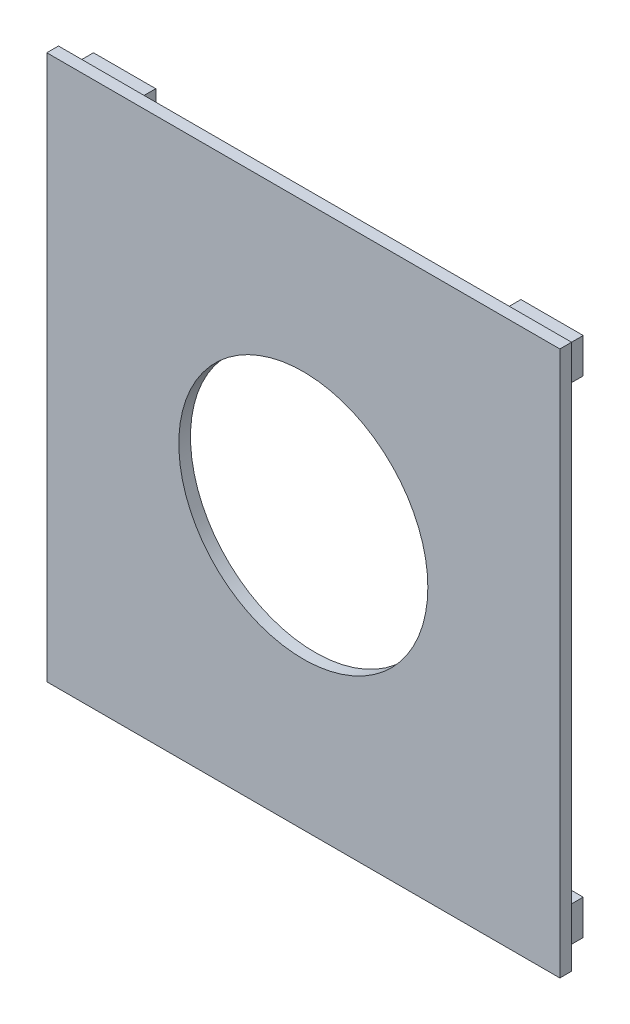
from build123d import *

# Parameters (mm, degrees)
SKETCH1_W                 = 65.925
SKETCH1_H                 = 70
BOSS_EXTRUDE1_DEPTH       = 1.5
SKETCH4_W                 = 8
SKETCH4_H                 = 4.5
SKETCH4_W_2               = 5
SKETCH4_H_2               = 1.5
BOSS_EXTRUDE2_DEPTH       = 3
MIRROR2_COPY_1_SKETCH_W   = 8
MIRROR2_COPY_1_SKETCH_H   = 4.5
MIRROR2_COPY_1_SKETCH_W_2 = 5
MIRROR2_COPY_1_SKETCH_H_2 = 1.5
MIRROR2_COPY_1_DEPTH      = 3
CUT_EXTRUDE1_REACH        = 137.335
SKETCH5_R                 = 16


with BuildPart() as part:
    # Sketch1 → Boss-Extrude1 (new body)
    with BuildSketch(Plane.XY):
        with Locations((88.1375, 25.25)):
            Rectangle(SKETCH1_W, SKETCH1_H)
    extrude(amount=BOSS_EXTRUDE1_DEPTH)

    # Sketch4 → Boss-Extrude2 (add)
    with BuildSketch(Plane(origin=(0, 0, 0), x_dir=(-1, 0, 0), z_dir=(0, 0, -1))):
        with Locations((-115.6, 56.5)):
            Rectangle(SKETCH4_W, SKETCH4_H)
        with Locations((-115.6, 56.5)):
            Rectangle(SKETCH4_W_2, SKETCH4_H_2, mode=Mode.SUBTRACT)
    boss_extrude2 = extrude(amount=BOSS_EXTRUDE2_DEPTH)

    # Mirror1: Boss-Extrude2 across plane
    add(boss_extrude2.mirror(Plane(origin=(88.1375, 0, 0), x_dir=(0, 0, 1), z_dir=(1, 0, 0))))

    # Mirror2: Boss-Extrude2 across plane
    add(boss_extrude2.mirror(Plane.ZX.offset(25.25)))

    # Mirror2 copy 1 sketch → Mirror2 copy 1 (add)
    with BuildSketch(Plane(origin=(176.275, 50.5, 0), x_dir=(1, 0, 0), z_dir=(0, 0, -1))):
        with Locations((-115.6, 56.5)):
            Rectangle(MIRROR2_COPY_1_SKETCH_W, MIRROR2_COPY_1_SKETCH_H)
        with Locations((-115.6, 56.5)):
            Rectangle(MIRROR2_COPY_1_SKETCH_W_2, MIRROR2_COPY_1_SKETCH_H_2, mode=Mode.SUBTRACT)
    extrude(amount=MIRROR2_COPY_1_DEPTH)

    # Sketch5 → Cut-Extrude1 (cut, up to next)
    with BuildSketch(Plane.XY.offset(1.5), mode=Mode.PRIVATE) as cut_extrude1_sk1:
        with Locations((88.1375, 25.25)):
            Circle(SKETCH5_R)
    cut_extrude1_tool1 = extrude(cut_extrude1_sk1.sketch, amount=-CUT_EXTRUDE1_REACH, mode=Mode.PRIVATE) & part.part
    add(cut_extrude1_tool1.solids().sort_by_distance((88.1375, 25.25, 1.5))[0], mode=Mode.SUBTRACT)


solid = part.part
